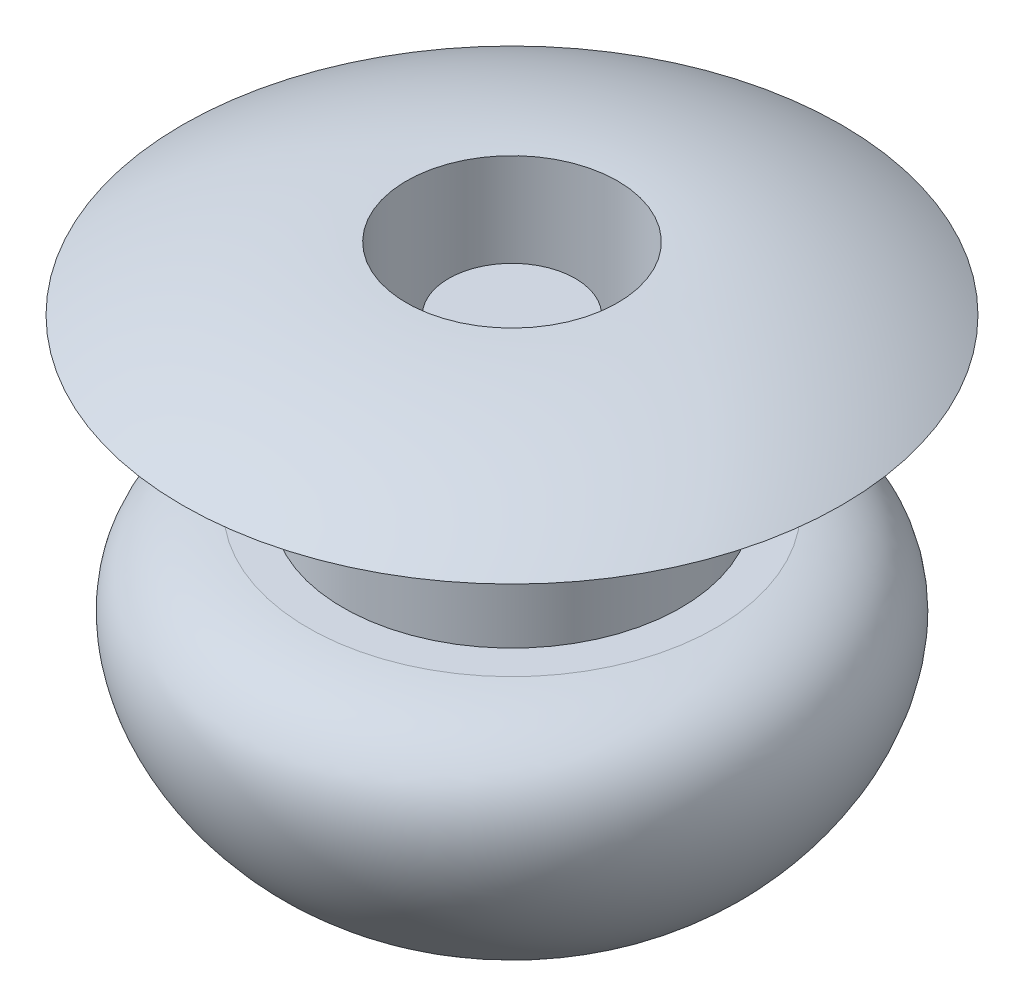
from build123d import *


with BuildPart() as part:
    # Szkic1 → Obrót1 (revolve)
    with BuildSketch(Plane(origin=(0, 0, 0), x_dir=(0, 0, -1), z_dir=(1, 0, 0))):
        with BuildLine():
            Line((0, 0), (0, -1.999991696))
            Line((0, -1.999991696), (0, -3.499991696))
            add(Edge.make_bspline(
                [(-0.956030427, -3.378182366), (-0.520263876, -3.499991696), (0, -3.499991696)],
                knots=[0.992852221, 0.992852221, 0.992852221, 1.570796327, 1.570796327, 1.570796327], degree=2, weights=[1, 0.958537313, 1]))
            add(Edge.make_bspline(
                [(-2.413891755, -1.999991696), (-3.858559437, -2.163288382), (-3.558358928, -4.322972058), (-0.971318098, -5.871931712), (-0.341145137, -3.792023605), (-0.956030427, -3.378182366)],
                knots=[0, 0, 0, 0, 0.454219308, 0.705200672, 1, 1, 1, 1], degree=3))
            Line((-2.413891755, -1.999991696), (-2, -1.999991696))
            Line((-2, -1.999991696), (-2, 0))
            Line((-2, 0), (-3.9, 0))
            ThreePointArc((-3.9, 0), (-2.627043935, 0.558888572), (-1.25, 0.75))
            Line((-1.25, 0.75), (-1.25, -1.999991696))
            Line((-1.25, -1.999991696), (-0.75, -1.999991696))
            Line((-0.75, -1.999991696), (-0.75, 0))
            Line((-0.75, 0), (0, 0))
        make_face()
    revolve(axis=Axis((0, 0, 0), (0, 1, 0)))


solid = part.part
